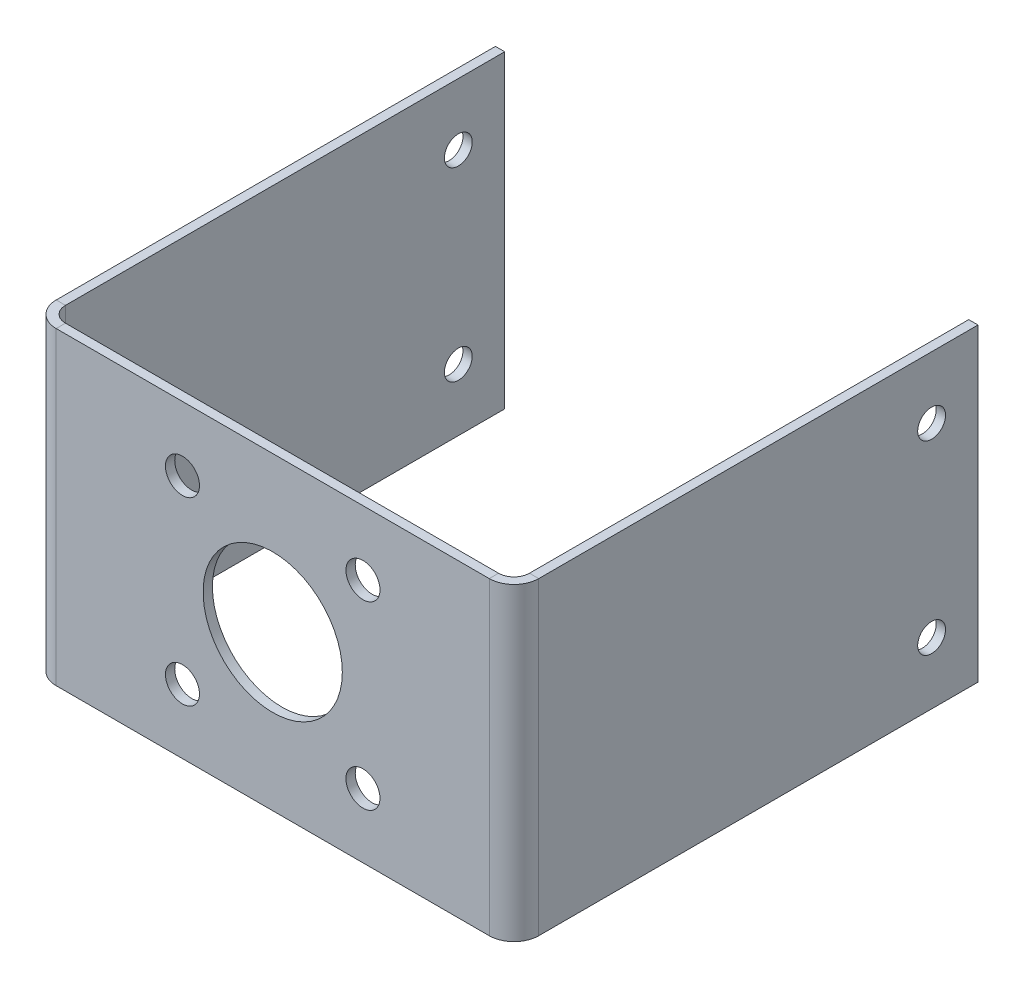
from build123d import *

# Parameters (mm, degrees)
SKETCH1_W                    = 312
SKETCH1_H                    = 200
BASE_FLANGE1_DEPTH           = 6
EDGE_FLANGE1_STRIP_W         = 44
EDGE_FLANGE1_STRIP_H         = 6
EDGE_FLANGE1_STRIP_CUT_DEPTH = 200
EDGE_FLANGE1_DEPTH           = 200
EDGE_FLANGE2_STRIP_W         = 44
EDGE_FLANGE2_STRIP_H         = 6
EDGE_FLANGE2_STRIP_CUT_DEPTH = 200
EDGE_FLANGE2_DEPTH           = 200
SKETCH24_R                   = 45
CUT_EXTRUDE1_DEPTH           = 10
SKETCH27_R                   = 11
CUT_EXTRUDE4_DEPTH           = 10
SKETCH28_R                   = 9
CUT_EXTRUDE5_DEPTH           = 445.234172481


# Sheet-metal steps are written as plain solids
with BuildPart() as part:
    # Sketch1 → Base-Flange1 (new body)
    with BuildSketch(Plane.XY):
        Rectangle(SKETCH1_W, SKETCH1_H)
    extrude(amount=-BASE_FLANGE1_DEPTH)

    # Edge-Flange1 strip (across the edge) → Edge-Flange1 strip cut (cut)
    with BuildSketch(Plane(origin=(-156, -100, -6), x_dir=(1, 0, 0), z_dir=(0, 1, 0))):
        with Locations((-6, -3)):
            Rectangle(EDGE_FLANGE1_STRIP_W, EDGE_FLANGE1_STRIP_H)
    extrude(amount=EDGE_FLANGE1_STRIP_CUT_DEPTH, mode=Mode.SUBTRACT)

    # Edge-Flange1 section (across the edge) → Edge-Flange1 (add)
    with BuildSketch(Plane(origin=(-156, -100, -6), x_dir=(1, 0, 0), z_dir=(0, 1, 0))):
        with BuildLine():
            Line((0, 10), (0, 294))
            Line((0, 294), (6, 294))
            Line((6, 294), (6, 10))
            ThreePointArc((6, 10), (8.928932188, 2.928932188), (16, 0))
            Line((16, 0), (16, -6))
            ThreePointArc((16, -6), (4.686291501, -1.313708499), (0, 10))
        make_face()
    extrude(amount=EDGE_FLANGE1_DEPTH)

    # Edge-Flange2 strip (across the edge) → Edge-Flange2 strip cut (cut)
    with BuildSketch(Plane(origin=(156, 100, -6), x_dir=(-1, 0, 0), z_dir=(0, -1, 0))):
        with Locations((-6, -3)):
            Rectangle(EDGE_FLANGE2_STRIP_W, EDGE_FLANGE2_STRIP_H)
    extrude(amount=EDGE_FLANGE2_STRIP_CUT_DEPTH, mode=Mode.SUBTRACT)

    # Edge-Flange2 section (across the edge) → Edge-Flange2 (add)
    with BuildSketch(Plane(origin=(156, 100, -6), x_dir=(-1, 0, 0), z_dir=(0, -1, 0))):
        with BuildLine():
            Line((0, 10), (0, 294))
            Line((0, 294), (6, 294))
            Line((6, 294), (6, 10))
            ThreePointArc((6, 10), (8.928932188, 2.928932188), (16, 0))
            Line((16, 0), (16, -6))
            ThreePointArc((16, -6), (4.686291501, -1.313708499), (0, 10))
        make_face()
    extrude(amount=EDGE_FLANGE2_DEPTH)

    # Sketch24 → Cut-Extrude1 (cut)
    with BuildSketch(Plane.XY):
        Circle(SKETCH24_R)
    extrude(amount=-CUT_EXTRUDE1_DEPTH, mode=Mode.SUBTRACT)

    # Sketch27 → Cut-Extrude4 (cut)
    with BuildSketch(Plane.XY):
        with Locations((58.35, 58.35)):
            Circle(SKETCH27_R)
        with Locations((58.35, -58.35)):
            Circle(SKETCH27_R)
        with Locations((-58.35, -58.35)):
            Circle(SKETCH27_R)
        with Locations((-58.35, 58.35)):
            Circle(SKETCH27_R)
    extrude(amount=-CUT_EXTRUDE4_DEPTH, mode=Mode.SUBTRACT)

    # Sketch28 → Cut-Extrude5 (cut, through all)
    with BuildSketch(Plane.ZY.offset(156)):
        with Locations((-270, 60)):
            Circle(SKETCH28_R)
        with Locations((-270, -60)):
            Circle(SKETCH28_R)
    extrude(amount=-CUT_EXTRUDE5_DEPTH, mode=Mode.SUBTRACT)


solid = part.part
